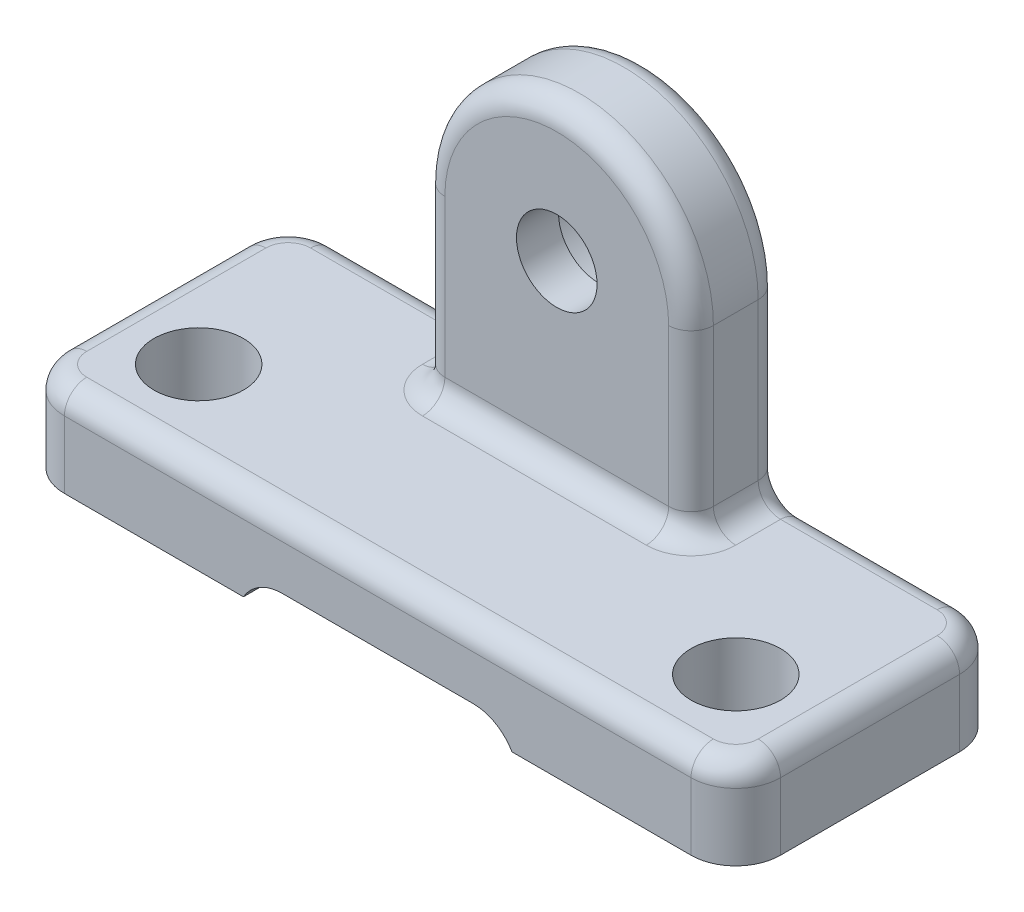
from build123d import *

# Parameters (mm, degrees)
SKETCH1_W                               = 80
SKETCH1_H                               = 30
BOSS_EXTRUDE1_DEPTH                     = 10
BOSS_EXTRUDE2_DEPTH                     = 10
SKETCH4_R                               = 15
BOSS_EXTRUDE3_DEPTH                     = 10
CBORE_FOR_M5_HEX_HEAD_BOLT1_D           = 9
CBORE_FOR_M5_HEX_HEAD_BOLT1_CBORE_D     = 18.01
CBORE_FOR_M5_HEX_HEAD_BOLT1_CBORE_DEPTH = 5.3
CUT_EXTRUDE1_REACH                      = 69.268
SKETCH7_W                               = 30
SKETCH7_H                               = 2.5
CUT_EXTRUDE2_REACH                      = 57.227
SKETCH8_R                               = 5
FILLET1_R                               = 5
FILLET2_R                               = 2.5


with BuildPart() as part:
    # Sketch1 → Boss-Extrude1 (new body)
    with BuildSketch(Plane(origin=(0, 0, 0), x_dir=(1, 0, 0), z_dir=(0, 1, 0))):
        Rectangle(SKETCH1_W, SKETCH1_H)
    extrude(amount=BOSS_EXTRUDE1_DEPTH)

    # Sketch2 → Boss-Extrude2 (add)
    with BuildSketch(Plane(origin=(0, 0, -15), x_dir=(-1, 0, 0), z_dir=(0, 0, -1))):
        Polygon((0, 30), (15, 30), (15, 0), (-15, 0), (-15, 30), align=None)
    extrude(amount=-BOSS_EXTRUDE2_DEPTH)

    # Sketch4 → Boss-Extrude3 (add)
    with BuildSketch(Plane(origin=(0, 0, -15), x_dir=(-1, 0, 0), z_dir=(0, 0, -1))):
        with Locations((0, 30)):
            Circle(SKETCH4_R)
    extrude(amount=-BOSS_EXTRUDE3_DEPTH)

    # CBORE for M5 Hex Head Bolt1 (through all)
    with Locations(Plane(origin=(0, 0, -15), x_dir=(-1, 0, 0), z_dir=(0, 0, -1))):
        with Locations((0, 30)):
            CounterBoreHole(CBORE_FOR_M5_HEX_HEAD_BOLT1_D / 2, CBORE_FOR_M5_HEX_HEAD_BOLT1_CBORE_D / 2, CBORE_FOR_M5_HEX_HEAD_BOLT1_CBORE_DEPTH)

    # Sketch7 → Cut-Extrude1 (cut, up to next)
    with BuildSketch(Plane.XY.offset(15), mode=Mode.PRIVATE) as cut_extrude1_sk1:
        with Locations((0, 1.25)):
            Rectangle(SKETCH7_W, SKETCH7_H)
    cut_extrude1_tool1 = extrude(cut_extrude1_sk1.sketch, amount=-CUT_EXTRUDE1_REACH, mode=Mode.PRIVATE) & part.part
    add(cut_extrude1_tool1.solids().sort_by_distance((0, 1.25, 15))[0], mode=Mode.SUBTRACT)

    # Sketch8 → Cut-Extrude2 (cut, up to next)
    with BuildSketch(Plane(origin=(0, 10, 0), x_dir=(1, 0, 0), z_dir=(0, 1, 0)), mode=Mode.PRIVATE) as cut_extrude2_sk1:
        with Locations(Location((-30, -5, 0), (0, 0, 270))):
            Circle(SKETCH8_R)
    cut_extrude2_tool1 = extrude(cut_extrude2_sk1.sketch, amount=-CUT_EXTRUDE2_REACH, mode=Mode.PRIVATE) & part.part
    # Sketch8 → Cut-Extrude2 (cut, up to next)
    with BuildSketch(Plane(origin=(0, 10, 0), x_dir=(1, 0, 0), z_dir=(0, 1, 0)), mode=Mode.PRIVATE) as cut_extrude2_sk2:
        with Locations(Location((30, -5, 0), (0, 0, 270))):
            Circle(SKETCH8_R)
    cut_extrude2_tool2 = extrude(cut_extrude2_sk2.sketch, amount=-CUT_EXTRUDE2_REACH, mode=Mode.PRIVATE) & part.part
    add(cut_extrude2_tool1.solids().sort_by_distance((-30, 10, 5))[0], mode=Mode.SUBTRACT)
    add(cut_extrude2_tool2.solids().sort_by_distance((30, 10, 5))[0], mode=Mode.SUBTRACT)

    # Fillet1
    # the kernel refuses this fillet: 5 mm, written as the material it adds along each edge
    with BuildSketch(Plane(origin=(15, 2.5, 15), x_dir=(-1, 0, 0), z_dir=(0, 0, -1))) as fillet1_piece_1:
        with BuildLine():
            CenterArc((4.330127019, -5), FILLET1_R, 90, 60)
            Line((0, -2.5), (0, 0))
            Line((0, 0), (4.330127019, 0))
        make_face()
    extrude(amount=30)
    with BuildSketch(Plane(origin=(-15, 2.5, 15), x_dir=(0, -1, 0), z_dir=(0, 0, -1))) as fillet1_piece_2:
        with BuildLine():
            CenterArc((5, -4.330127019), FILLET1_R, 120, 60)
            Line((0, -4.330127019), (0, 0))
            Line((0, 0), (2.5, 0))
        make_face()
    extrude(amount=30)
    # the kernel refuses this fillet: 5 mm, written as the material it takes off along each edge
    with BuildSketch(Plane(origin=(-40, -12.5, -15), x_dir=(0, 0, 1), z_dir=(0, 1, 0)), Plane(origin=(-40, -12.5, 15), x_dir=(1, 0, 0), z_dir=(0, 1, 0))) as fillet1_2_piece_1:
        with BuildLine():
            CenterArc((FILLET1_R, FILLET1_R), FILLET1_R, 180, 90)
            Line((0, FILLET1_R), (0, 0))
            Line((0, 0), (FILLET1_R, 0))
        make_face()
    extrude(amount=35, mode=Mode.SUBTRACT)
    with BuildSketch(Plane(origin=(40, -12.5, -15), x_dir=(0, 0, 1), z_dir=(0, 1, 0)), Plane(origin=(40, -12.5, 15), x_dir=(-1, 0, 0), z_dir=(0, 1, 0))) as fillet1_2_piece_2:
        with BuildLine():
            CenterArc((FILLET1_R, -FILLET1_R), FILLET1_R, 90, 90)
            Line((0, -FILLET1_R), (0, 0))
            Line((0, 0), (FILLET1_R, 0))
        make_face()
    extrude(amount=35, mode=Mode.SUBTRACT)

    # Fillet2
    fillet2_edges = [part.edges().sort_by_distance(p)[0] for p in [
        (-25, 10, -15),
        (-15, 20, -5),
        (15, 10, -10),
        (15, 20, -15),
        (15, 20, -5),
        (-15, 20, -15),
        (-15, 10, -10),
        (0, 10, -5),
        (0, 45, -15),
        (0, 45, -5),
        (-40, 10, 0),
        (25, 10, -15),
        (0, 10, 15),
        (40, 10, 0),
        (38.535533906, 10, 13.535533906),
        (38.535533906, 10, -13.535533906),
        (-38.535533906, 10, 13.535533906),
        (-38.535533906, 10, -13.535533906),
    ]]
    fillet(fillet2_edges, radius=FILLET2_R)


solid = part.part
